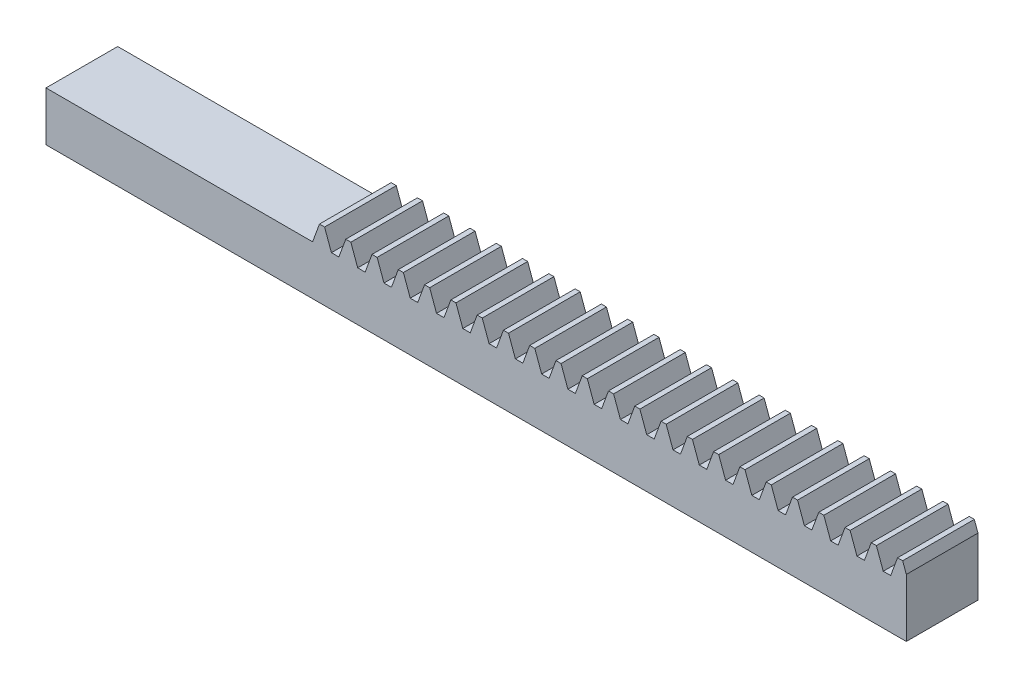
from build123d import *

# Parameters (mm, degrees)
BLANKSKE_W        = 50
BLANKSKE_H        = 5.7
BLANK_DEPTH       = 6
TOOTHCUTSIM_DEPTH = 51.680272296
TEETHCUTS_COUNT   = 24
TEETHCUTS_PITCH   = 2.199114855
SKETCH_1_W        = 6
SKETCH_1_H        = 4.125
EXTRUDE_1_DEPTH   = 22


with BuildPart() as part:
    # BlankSke → Blank (new body)
    with BuildSketch(Plane.XY):
        with Locations((25, 2.85)):
            Rectangle(BLANKSKE_W, BLANKSKE_H)
    extrude(amount=-BLANK_DEPTH)

    # TooCutSkeSim → ToothCutSim (cut, through all)
    with BuildSketch(Plane.XY):
        Polygon((0.312304759, 4.125), (-0.312304759, 4.125), (-0.894802722, 5.7254), (0.894802722, 5.7254), align=None)
    toothcutsim = extrude(amount=-TOOTHCUTSIM_DEPTH, mode=Mode.SUBTRACT)

    # TeethCuts: ToothCutSim ×24
    with Locations(*[(i * TEETHCUTS_PITCH, 0, 0) for i in range(1, TEETHCUTS_COUNT)]):
        add(toothcutsim, mode=Mode.SUBTRACT)

    # 草图1 → 凸台-拉伸1 (add)
    with BuildSketch(Plane.ZY):
        with Locations((-3, 2.0625)):
            Rectangle(SKETCH_1_W, SKETCH_1_H)
    extrude(amount=EXTRUDE_1_DEPTH)


solid = part.part
